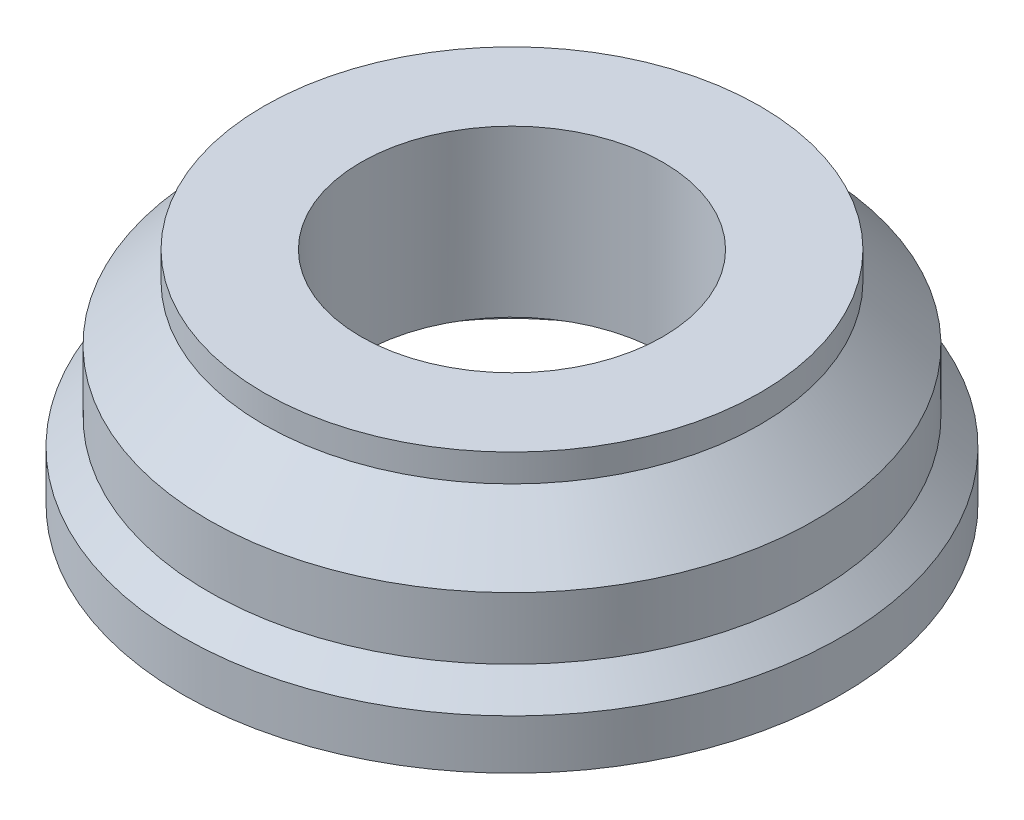
from build123d import *

# Parameters (mm, degrees)
SZKIC1_R                    = 9
SZKIC1_R_2                  = 5.477333333
DODANIE_WYCI_GNI_CIE1_DEPTH = 8
SZKIC1_3_R                  = 11
SZKIC1_3_R_2                = 9
DODANIE_WYCI_GNI_CIE2_DEPTH = 7
SZKIC1_4_R                  = 11.95
SZKIC1_4_R_2                = 11
DODANIE_WYCI_GNI_CIE3_DEPTH = 3
DODANIE_WYCI_GNI_CIE4_START = -3
SZKIC1_5_R                  = 11.95
SZKIC1_5_R_2                = 1.65
SZKIC1_5_R_3                = 11
SZKIC1_5_R_4                = 9
SZKIC1_5_R_5                = 5.477333333
DODANIE_WYCI_GNI_CIE4_DEPTH = 3
SZKIC2_R                    = 8.25
WYTNIJ_WYCI_GNI_CIE1_DEPTH  = 5
SFAZOWANIE1_SIZE            = 1.2
DODANIE_WYCI_GNI_CIE5_START = 17
SZKIC3_R                    = 1.65
DODANIE_WYCI_GNI_CIE5_DEPTH = 17
ZAOKR_GLENIE1_R             = 10
ZAOKR_GLENIE2_R             = 4
SFAZOWANIE2_SIZE            = 2
WYTNIJ_WYCI_GNI_CIE3_DEPTH  = 81.474279011


# Some blends are built 0.0001 mm under size
with BuildPart() as part:
    # Szkic1 → Dodanie-wyciągnięcie1 (new body)
    with BuildSketch(Plane(origin=(0, 0, 0), x_dir=(1, 0, 0), z_dir=(0, 1, 0))):
        with Locations(Location((-48.017326928, 15.231452718, 0), (0, 0, 270))):
            Circle(SZKIC1_R)
        with Locations(Location((-48.017326928, 15.231452718, 0), (0, 0, 270))):
            Circle(SZKIC1_R_2, mode=Mode.SUBTRACT)
    extrude(amount=DODANIE_WYCI_GNI_CIE1_DEPTH)

    # Szkic1<3> → Dodanie-wyciągnięcie2 (add)
    with BuildSketch(Plane(origin=(0, 0, 0), x_dir=(1, 0, 0), z_dir=(0, 1, 0))):
        with Locations(Location((-48.017326928, 15.231452718, 0), (0, 0, 270))):
            Circle(SZKIC1_3_R)
        with Locations(Location((-48.017326928, 15.231452718, 0), (0, 0, 270))):
            Circle(SZKIC1_3_R_2, mode=Mode.SUBTRACT)
    extrude(amount=DODANIE_WYCI_GNI_CIE2_DEPTH)

    # Szkic1<4> → Dodanie-wyciągnięcie3 (add)
    with BuildSketch(Plane(origin=(0, 0, 0), x_dir=(1, 0, 0), z_dir=(0, 1, 0))):
        with Locations(Location((-48.017326928, 15.231452718, 0), (0, 0, 270))):
            Circle(SZKIC1_4_R)
        with Locations(Location((-48.017326928, 15.231452718, 0), (0, 0, 270))):
            Circle(SZKIC1_4_R_2, mode=Mode.SUBTRACT)
    extrude(amount=DODANIE_WYCI_GNI_CIE3_DEPTH)

    # Szkic1<5> → Dodanie-wyciągnięcie4 (add)
    # profile 1 of 4: a face of its own
    with BuildSketch(Plane(origin=(0, 0, 0), x_dir=(1, 0, 0), z_dir=(0, 1, 0)).offset(DODANIE_WYCI_GNI_CIE4_START)):
        with BuildLine():
            Line((-69.017326928, 26.22592553), (-69.017326928, 4.236979905))
            ThreePointArc((-69.017326928, 4.236979905), (-67.978820752, -1.151729035), (-65.012060165, -5.768547282))
            Line((-65.012060165, -5.768547282), (-50.017326928, -5.768547282))
            Line((-50.017326928, -5.768547282), (-30.833560744, -5.768547282))
            Line((-30.833560744, -5.768547282), (-26.817326928, -1.752313466))
            Line((-26.817326928, -1.752313466), (-26.817326928, 32.215218902))
            Line((-26.817326928, 32.215218902), (-30.833560744, 36.231452718))
            Line((-30.833560744, 36.231452718), (-50.017326928, 36.231452718))
            Line((-50.017326928, 36.231452718), (-65.012060165, 36.231452718))
            ThreePointArc((-65.012060165, 36.231452718), (-67.978820752, 31.61463447), (-69.017326928, 26.22592553))
        make_face()
        with Locations(Location((-48.017326928, 15.231452718, 0), (0, 0, 270))):
            Circle(SZKIC1_5_R, mode=Mode.SUBTRACT)
        with Locations(Location((-63.517326928, -0.268547282, 0), (0, 0, 270))):
            Circle(SZKIC1_5_R_2, mode=Mode.SUBTRACT)
        with Locations(Location((-32.517326928, -0.268547282, 0), (0, 0, 270))):
            Circle(SZKIC1_5_R_2, mode=Mode.SUBTRACT)
        with Locations(Location((-32.517326928, 30.731452718, 0), (0, 0, 270))):
            Circle(SZKIC1_5_R_2, mode=Mode.SUBTRACT)
        with Locations(Location((-63.517326928, 30.731452718, 0), (0, 0, 270))):
            Circle(SZKIC1_5_R_2, mode=Mode.SUBTRACT)
    # profile 2 of 4: a face of its own
    with BuildSketch(Plane(origin=(0, 0, 0), x_dir=(1, 0, 0), z_dir=(0, 1, 0)).offset(DODANIE_WYCI_GNI_CIE4_START)):
        with Locations(Location((-48.017326928, 15.231452718, 0), (0, 0, 270))):
            Circle(SZKIC1_5_R)
        with Locations(Location((-48.017326928, 15.231452718, 0), (0, 0, 270))):
            Circle(SZKIC1_5_R_3, mode=Mode.SUBTRACT)
    # profile 3 of 4: a face of its own
    with BuildSketch(Plane(origin=(0, 0, 0), x_dir=(1, 0, 0), z_dir=(0, 1, 0)).offset(DODANIE_WYCI_GNI_CIE4_START)):
        with Locations(Location((-48.017326928, 15.231452718, 0), (0, 0, 270))):
            Circle(SZKIC1_5_R_3)
        with Locations(Location((-48.017326928, 15.231452718, 0), (0, 0, 270))):
            Circle(SZKIC1_5_R_4, mode=Mode.SUBTRACT)
    # profile 4 of 4: a face of its own
    with BuildSketch(Plane(origin=(0, 0, 0), x_dir=(1, 0, 0), z_dir=(0, 1, 0)).offset(DODANIE_WYCI_GNI_CIE4_START)):
        with Locations(Location((-48.017326928, 15.231452718, 0), (0, 0, 270))):
            Circle(SZKIC1_5_R_4)
        with Locations(Location((-48.017326928, 15.231452718, 0), (0, 0, 270))):
            Circle(SZKIC1_5_R_5, mode=Mode.SUBTRACT)
    extrude(amount=DODANIE_WYCI_GNI_CIE4_DEPTH)

    # Szkic2 → Wytnij-wyciągnięcie1 (cut)
    with BuildSketch(Plane.XZ.offset(3)):
        with Locations(Location((-48.017326928, -15.231452718, 0), (0, 0, 270))):
            Circle(SZKIC2_R)
    extrude(amount=-WYTNIJ_WYCI_GNI_CIE1_DEPTH, mode=Mode.SUBTRACT)

    # Sfazowanie1
    # the kernel refuses this chamfer: 1.2 mm, written as the material it takes off along each edge
    with BuildSketch(Plane(origin=(-48.017326928, 3, -15.231452718), x_dir=(0, 0, 1), z_dir=(-1, 0, 0))) as sfazowanie1_piece_1_section:
        Polygon((11.95 - SFAZOWANIE1_SIZE, 0), (11.95, -SFAZOWANIE1_SIZE), (11.95, 0), align=None)
    sfazowanie1_piece_1 = revolve(axis=Axis((-48.017326928, 3, -15.231452718), (0, 1, 0)), mode=Mode.PRIVATE)
    sfazowanie1_piece_1 = sfazowanie1_piece_1 - Plane(origin=(-48.017326928, 2.284838346, -15.231452718), x_dir=(0, 0, 1), z_dir=(0, -1, 0)) * Cylinder(11, 48, mode=Mode.PRIVATE)
    add(sfazowanie1_piece_1, mode=Mode.SUBTRACT)

    # Szkic3 → Dodanie-wyciągnięcie5 (add)
    with BuildSketch(Plane.XZ.offset(3).offset(DODANIE_WYCI_GNI_CIE5_START)):
        with BuildLine():
            Line((-69.017326928, -26.22592553), (-36.817326928, -26.22592553))
            Line((-36.817326928, -26.22592553), (-36.817326928, -4.236979905))
            Line((-36.817326928, -4.236979905), (-69.017326928, -4.236979905))
            ThreePointArc((-69.017326928, -4.236979905), (-67.978820752, 1.151729035), (-65.012060165, 5.768547282))
            Line((-65.012060165, 5.768547282), (-30.833560744, 5.768547282))
            Line((-30.833560744, 5.768547282), (-26.817326928, 1.752313466))
            Line((-26.817326928, 1.752313466), (-26.817326928, -32.215218902))
            Line((-26.817326928, -32.215218902), (-30.833560744, -36.231452718))
            Line((-30.833560744, -36.231452718), (-65.012060165, -36.231452718))
            ThreePointArc((-65.012060165, -36.231452718), (-67.978820752, -31.61463447), (-69.017326928, -26.22592553))
        make_face()
        with Locations(Location((-63.517326928, 0.268547282, 0), (0, 0, 90))):
            Circle(SZKIC3_R, mode=Mode.SUBTRACT)
        with Locations(Location((-32.517326928, 0.268547282, 0), (0, 0, 90))):
            Circle(SZKIC3_R, mode=Mode.SUBTRACT)
        with Locations(Location((-32.517326928, -30.731452718, 0), (0, 0, 90))):
            Circle(SZKIC3_R, mode=Mode.SUBTRACT)
        with Locations(Location((-63.517326928, -30.731452718, 0), (0, 0, 90))):
            Circle(SZKIC3_R, mode=Mode.SUBTRACT)
    extrude(amount=-DODANIE_WYCI_GNI_CIE5_DEPTH)

    # Zaokrąglenie1
    zaokr_glenie1_edges = [part.edges().sort_by_distance(p)[0] for p in [
        (-36.817326928, -11.5, -4.236979905),
        (-36.817326928, -11.5, -26.22592553),
    ]]
    fillet(zaokr_glenie1_edges, radius=ZAOKR_GLENIE1_R)

    # Zaokrąglenie2
    zaokr_glenie2_edges = [part.edges().sort_by_distance(p)[0] for p in [
        (-65.012060165, -10, -36.231452718),
        (-30.833560744, -10, -36.231452718),
        (-26.817326928, -10, -32.215218902),
        (-26.817326928, -10, 1.752313466),
        (-30.833560744, -10, 5.768547282),
        (-65.012060165, -10, 5.768547282),
        (-69.017326928, -11.5, -26.22592553),
        (-69.017326928, -11.5, -4.236979905),
    ]]
    fillet(zaokr_glenie2_edges, radius=ZAOKR_GLENIE2_R)

    # Sfazowanie2
    sfazowanie2_edges = [part.edges().sort_by_distance(p)[0] for p in [
        (-48.017326928, 7, -26.231452718),
    ]]
    chamfer(sfazowanie2_edges, length=SFAZOWANIE2_SIZE - 0.0001)  # a hair under: the kernel refuses the full size

    # Szkic5 → Wytnij-wyciągnięcie3 (cut, through all)
    with BuildSketch(Plane(origin=(0, 0, 0), x_dir=(1, 0, 0), z_dir=(0, 1, 0))):
        with BuildLine():
            Line((-63.130319625, -5.768547282), (-32.490414994, -5.768547282))
            ThreePointArc((-32.490414994, -5.768547282), (-30.959681264, -5.464065412), (-29.661987869, -4.596974407))
            Line((-29.661987869, -4.596974407), (-27.988899803, -2.923886342))
            ThreePointArc((-27.988899803, -2.923886342), (-27.121808798, -1.626192946), (-26.817326928, -0.095459217))
            Line((-26.817326928, -0.095459217), (-26.817326928, 30.558364652))
            ThreePointArc((-26.817326928, 30.558364652), (-27.121808798, 32.089098382), (-27.988899803, 33.386791777))
            Line((-27.988899803, 33.386791777), (-29.661987869, 35.059879842))
            ThreePointArc((-29.661987869, 35.059879842), (-30.959681264, 35.926970848), (-32.490414994, 36.231452718))
            Line((-32.490414994, 36.231452718), (-63.130319625, 36.231452718))
            ThreePointArc((-63.130319625, 36.231452718), (-64.980822324, 35.777667568), (-66.411459701, 34.519272599))
            ThreePointArc((-66.411459701, 34.519272599), (-68.350528387, 30.572480189), (-69.017326928, 26.22592553))
            Line((-69.017326928, 26.22592553), (-69.017326928, 4.236979905))
            ThreePointArc((-69.017326928, 4.236979905), (-68.350528387, -0.109574754), (-66.411459701, -4.056367163))
            ThreePointArc((-66.411459701, -4.056367163), (-64.980822324, -5.314762132), (-63.130319625, -5.768547282))
        make_face()
    extrude(amount=-WYTNIJ_WYCI_GNI_CIE3_DEPTH, mode=Mode.SUBTRACT)


solid = part.part
